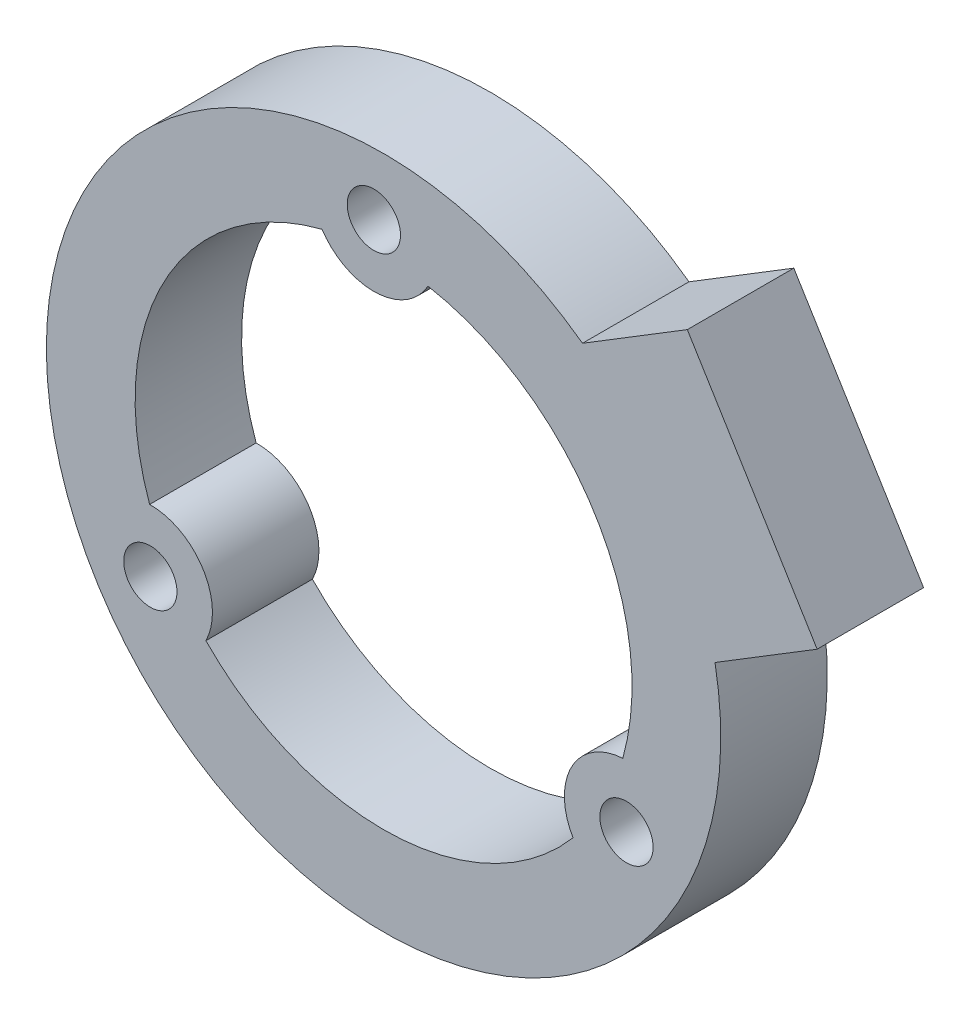
from build123d import *

# Parameters (mm, degrees)
ESQUISSE1_R        = 1.5
BOSS_EXTRU_3_DEPTH = 6


with BuildPart() as part:
    # Esquisse1 → Boss.-Extru.3 (new body)
    with BuildSketch(Plane.XY):
        with BuildLine():
            Line((20.773195388, 12.991295683), (24.430844118, 7.022911834))
            Line((24.430844118, 7.022911834), (18.675618398, 3.495894373))
            ThreePointArc((18.675618398, 3.495894373), (-16.073678409, -10.130985263), (11.210090708, 15.340595371))
            Line((11.210090708, 15.340595371), (17.115546658, 18.959679532))
            Line((17.115546658, 18.959679532), (20.773195388, 12.991295683))
        make_face()
        with Locations((-0.546712729, 15.490355231)):
            Circle(ESQUISSE1_R, mode=Mode.SUBTRACT)
        with Locations((-13.14168478, -8.218644727)):
            Circle(ESQUISSE1_R, mode=Mode.SUBTRACT)
        with Locations((13.688397508, -7.271710504)):
            Circle(ESQUISSE1_R, mode=Mode.SUBTRACT)
        with BuildLine():
            ThreePointArc((-3.468577117, 13.56351624), (-0.423261467, 11.992533082), (2.503723019, 13.774301109))
            ThreePointArc((2.503723019, 13.774301109), (11.869908833, 7.423292012), (13.480638187, -3.777882222))
            ThreePointArc((13.480638187, -3.777882222), (10.597469039, -5.629711358), (10.677033171, -9.055438293))
            ThreePointArc((10.677033171, -9.055438293), (0.493805045, -13.991288596), (-10.01206107, -9.785634018))
            ThreePointArc((-10.01206107, -9.785634018), (-10.174207571, -6.362821724), (-13.180756189, -4.718862816))
            ThreePointArc((-13.180756189, -4.718862816), (-12.363713879, 6.567996584), (-3.468577117, 13.56351624))
        make_face(mode=Mode.SUBTRACT)
    extrude(amount=BOSS_EXTRU_3_DEPTH)


solid = part.part
